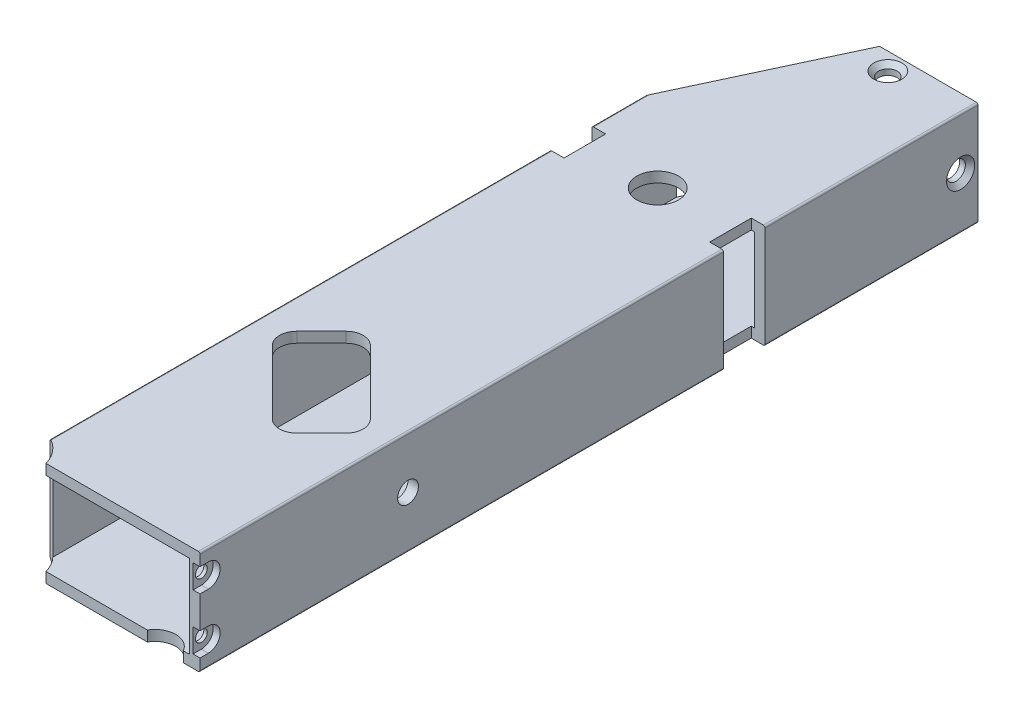
from build123d import *

# Parameters (mm, degrees)
SKETCH_1_W              = 22
SKETCH_1_H              = 12
EXTRUDE_1_DEPTH         = 112.2
SKETCH_2_R              = 3
SKETCH_2_W              = 2
SKETCH_2_H              = 6
CUT_EXTRUDE_1_DEPTH     = 116.926010886
SKETCH_3_R              = 1.5
CUT_EXTRUDE_2_DEPTH     = 116.926010886
CUT_EXTRUDE_5_DEPTH     = 116.926010886
HOLE_WIZARD_2_561_D     = 1.778
HOLE_WIZARD_2_561_DEPTH = 1.5
CUT_EXTRUDE_7_DEPTH     = 116.926010886
CUT_EXTRUDE_8_REACH     = 117.926
SKETCH_13_R             = 0.85
CUT_EXTRUDE_START       = 24
CUT_EXTRUDE_9_OUTLINE_R = 0.85
CUT_EXTRUDE_9_DEPTH     = 1
CUT_EXTRUDE_10_DEPTH    = 116.74147918


# Read off the part's stored shape, not the designer's step: Вырез-Вытянуть9
with BuildPart() as part:
    # Эскиз1 → Вытянуть1 (new body)
    with BuildSketch(Plane.XY):
        with BuildLine():
            Line((0.25, 0), (24.75, 0))
            ThreePointArc((24.75, 0), (24.926776695, 0.073223305), (25, 0.25))
            Line((25, 0.25), (25, 14.75))
            ThreePointArc((25, 14.75), (24.926776695, 14.926776695), (24.75, 15))
            Line((24.75, 15), (0.25, 15))
            ThreePointArc((0.25, 15), (0.073223305, 14.926776695), (0, 14.75))
            Line((0, 14.75), (0, 0.25))
            ThreePointArc((0, 0.25), (0.073223305, 0.073223305), (0.25, 0))
        make_face()
        with Locations((12.5, 7.5)):
            Rectangle(SKETCH_1_W, SKETCH_1_H, mode=Mode.SUBTRACT)
    extrude(amount=EXTRUDE_1_DEPTH)

    # Эскиз2 → Вырез-Вытянуть1 (cut, through all)
    with BuildSketch(Plane(origin=(0, 15, 0), x_dir=(1, 0, 0), z_dir=(0, 1, 0))):
        with Locations(Location((12.5, -33.7, 0), (0, 0, 270))):
            Circle(SKETCH_2_R)
        with BuildLine():
            Line((13.560660172, -90.331727984), (4.368272016, -81.139339828))
            ThreePointArc((4.368272016, -81.139339828), (3.636038969, -79.371572875), (4.368272016, -77.603805922))
            Line((4.368272016, -77.603805922), (7.903805922, -74.068272016))
            ThreePointArc((7.903805922, -74.068272016), (9.671572875, -73.336038969), (11.439339828, -74.068272016))
            Line((11.439339828, -74.068272016), (20.631727984, -83.260660172))
            ThreePointArc((20.631727984, -83.260660172), (21.363961031, -85.028427125), (20.631727984, -86.796194078))
            Line((20.631727984, -86.796194078), (17.096194078, -90.331727984))
            ThreePointArc((17.096194078, -90.331727984), (15.328427125, -91.063961031), (13.560660172, -90.331727984))
        make_face()
        with Locations((1, -33.7)):
            Rectangle(SKETCH_2_W, SKETCH_2_H)
        with Locations((24, -33.7)):
            Rectangle(SKETCH_2_W, SKETCH_2_H)
    extrude(amount=-CUT_EXTRUDE_1_DEPTH, mode=Mode.SUBTRACT)

    # Эскиз3 → Вырез-Вытянуть2 (cut, through all)
    with BuildSketch(Plane.ZY):
        with Locations((82.2, 7.5)):
            Circle(SKETCH_3_R)
    extrude(amount=-CUT_EXTRUDE_2_DEPTH, mode=Mode.SUBTRACT)

    # Эскиз6 → Вырез-Вытянуть5 (cut, through all)
    with BuildSketch(Plane(origin=(0, 15, 0), x_dir=(1, 0, 0), z_dir=(0, 1, 0))):
        Polygon((110.629924484, 214.057863156), (10.813103606, 0), (0, -23.188775515), (-99.816820878, -237.246638671), (-527.932547189, -37.612996915), (-317.485801828, 413.691504911), align=None)
    extrude(amount=-CUT_EXTRUDE_5_DEPTH, mode=Mode.SUBTRACT)

    # Эскиз8 → Зенковка для  винта с плоской головкой #2(100)2 (revolve, cut)
    with BuildSketch(Plane(origin=(14.5, 15, 2.5), x_dir=(0, 0, 1), z_dir=(1, 0, 0))):
        Polygon((0, 0), (0, 1.5), (1.35255, 1.5), (1.35255, 0.67945), (2.032, 0), align=None)
    revolve(axis=Axis((14.5, 21.35, 2.5), (0, -1, 0)), mode=Mode.SUBTRACT)

    # Эскиз8 at point 2 (carried to point 2, square into its face) → Зенковка для  винта с плоской головкой #2(100)2 at 2 (revolve, cut)
    with BuildSketch(Plane(origin=(14.5, 0, 2.5), x_dir=(0, 0, 1), z_dir=(-1, 0, 0))):
        Polygon((0, 0), (0, 1.5), (1.35255, 1.5), (1.35255, 0.67945), (2.032, 0), align=None)
    revolve(axis=Axis((14.5, -6.35, 2.5), (0, 1, 0)), mode=Mode.SUBTRACT)

    # Эскиз8 at point 3 (carried to point 3, square into its face) → Зенковка для  винта с плоской головкой #2(100)2 at 3 (revolve, cut)
    with BuildSketch(Plane(origin=(25, 7.5, 2.5), x_dir=(0, 0, 1), z_dir=(0, -1, 0))):
        Polygon((0, 0), (0, 1.5), (1.35255, 1.5), (1.35255, 0.67945), (2.032, 0), align=None)
    revolve(axis=Axis((31.35, 7.5, 2.5), (-1, 0, 0)), mode=Mode.SUBTRACT)

    # Отверстие обработанное метчиком #2-561
    with Locations(Plane.ZY):
        with Locations((27.7, 10.5), (46.2, 2.5)):
            Hole(HOLE_WIZARD_2_561_D / 2, depth=HOLE_WIZARD_2_561_DEPTH)

    # Эскиз12 → Вырез-Вытянуть7 (cut, through all)
    with BuildSketch(Plane.XZ.offset(-15)):
        with BuildLine():
            ThreePointArc((2.791502622, 112.2), (2.947626291, 112.942789468), (3, 113.7))
            ThreePointArc((3, 113.7), (-7.263139721, 116.45), (0.25, 108.936860279))
            Line((0.25, 108.936860279), (0.25, 112.2))
            Line((0.25, 112.2), (2.791502622, 112.2))
        make_face()
        with BuildLine():
            Line((0.25, 112.2), (0.25, 108.936860279))
            ThreePointArc((0.25, 108.936860279), (1.839177493, 110.320423298), (2.791502622, 112.2))
            Line((2.791502622, 112.2), (0.25, 112.2))
        make_face()
    extrude(amount=CUT_EXTRUDE_7_DEPTH, mode=Mode.SUBTRACT)

    # Эскиз13 → Вырез-Вытянуть8 (cut, up to next)
    with BuildSketch(Plane(origin=(25, 0, 0), x_dir=(0, 0, -1), z_dir=(1, 0, 0)), mode=Mode.PRIVATE) as cut_extrude_8_sk1:
        with Locations((-111, 11.5)):
            Circle(SKETCH_13_R)
    cut_extrude_8_tool1 = extrude(cut_extrude_8_sk1.sketch, amount=-CUT_EXTRUDE_8_REACH, mode=Mode.PRIVATE) & part.part
    # Эскиз13 → Вырез-Вытянуть8 (cut, up to next)
    with BuildSketch(Plane(origin=(25, 0, 0), x_dir=(0, 0, -1), z_dir=(1, 0, 0)), mode=Mode.PRIVATE) as cut_extrude_8_sk2:
        with Locations((-111, 3.5)):
            Circle(SKETCH_13_R)
    cut_extrude_8_tool2 = extrude(cut_extrude_8_sk2.sketch, amount=-CUT_EXTRUDE_8_REACH, mode=Mode.PRIVATE) & part.part
    add(cut_extrude_8_tool1.solids().sort_by_distance((25, 11.5, 111))[0], mode=Mode.SUBTRACT)
    add(cut_extrude_8_tool2.solids().sort_by_distance((25, 3.5, 111))[0], mode=Mode.SUBTRACT)

    # Вырез-Вытянуть9 outline → Вырез-Вытянуть9 (cut)
    # profile 1 of 2: a face of its own
    with BuildSketch(Plane.YZ.offset(CUT_EXTRUDE_START)):
        with BuildLine():
            Line((1.8, 112.2), (1.8, 111))
            ThreePointArc((1.8, 111), (3.5, 109.3), (5.2, 111))
            Line((5.2, 111), (5.2, 112.2))
            Line((5.2, 112.2), (1.8, 112.2))
        make_face()
        with Locations((3.5, 111)):
            Circle(CUT_EXTRUDE_9_OUTLINE_R, mode=Mode.SUBTRACT)
    # profile 2 of 2: a face of its own
    with BuildSketch(Plane.YZ.offset(CUT_EXTRUDE_START)):
        with BuildLine():
            Line((13.2, 112.2), (9.8, 112.2))
            Line((9.8, 112.2), (9.8, 111))
            ThreePointArc((9.8, 111), (11.5, 109.3), (13.2, 111))
            Line((13.2, 111), (13.2, 112.2))
        make_face()
        with Locations((11.5, 111)):
            Circle(CUT_EXTRUDE_9_OUTLINE_R, mode=Mode.SUBTRACT)
    extrude(amount=CUT_EXTRUDE_9_DEPTH, mode=Mode.SUBTRACT)

    # Эскиз14 → Вырез-Вытянуть10 (cut, through all)
    with BuildSketch(Plane(origin=(0, 1.5, 0), x_dir=(1, 0, 0), z_dir=(0, 1, 0))):
        with BuildLine():
            Line((-102.051180376, -319.098845535), (17.401923789, -112.2))
            ThreePointArc((17.401923789, -112.2), (20, -110.7), (22.598076211, -112.2))
            Line((22.598076211, -112.2), (142.051180376, -319.098845535))
            Line((142.051180376, -319.098845535), (142.051180376, -796.911262195))
            Line((142.051180376, -796.911262195), (-102.051180376, -796.911262195))
            Line((-102.051180376, -796.911262195), (-102.051180376, -319.098845535))
        make_face()
    extrude(amount=-CUT_EXTRUDE_10_DEPTH, mode=Mode.SUBTRACT)


solid = part.part
